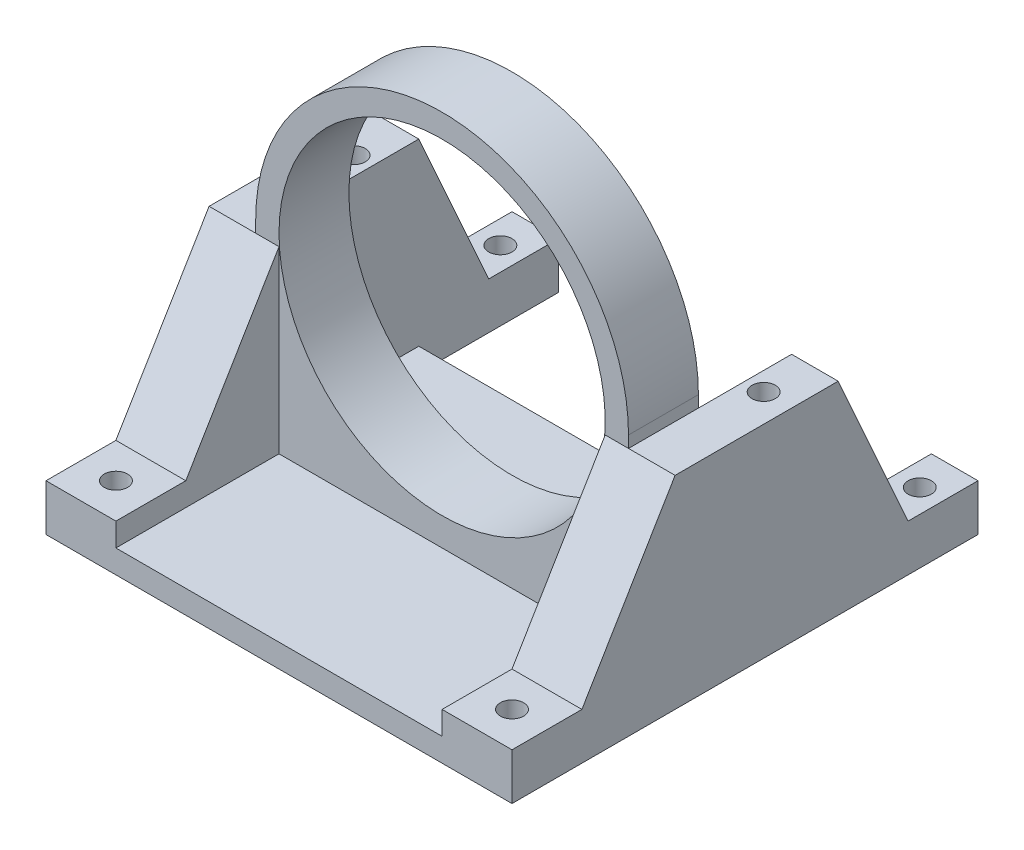
from build123d import *

# Parameters (mm, degrees)
SKETCH1_R                = 101.6
SKETCH1_R_2              = 88.9
BOSS_EXTRUDE1_DEPTH      = 38.1
SKETCH2_W                = 254
SKETCH2_H                = 177.8
BOSS_EXTRUDE2_DEPTH      = 12.7
BOSS_EXTRUDE3_REACH      = 275.106
BOSS_EXTRUDE3_END_RADIUS = 101.6
SKETCH3_W                = 203.2
SKETCH3_H                = 38.1
SKETCH10_W               = 25.4
SKETCH10_H               = 88.9
BOSS_EXTRUDE5_DEPTH      = 97.79
SKETCH11_R               = 6.35
CUT_EXTRUDE1_DEPTH       = 38.1
RIB3_START               = -38.1
RIB3_DEPTH               = 38.1
BOSS_EXTRUDE6_DEPTH      = 25.4
BOSS_EXTRUDE7_DEPTH      = 25.4
SKETCH17_R               = 6.35
CUT_EXTRUDE2_DEPTH       = 25.4


# Read off the part's stored shape, not the designer's step: Rib3
with BuildPart() as part:
    # Sketch1 → Boss-Extrude1 (new body)
    with BuildSketch(Plane.XY):
        with Locations(Location((0, 0, 0), (0, 0, 180))):
            Circle(SKETCH1_R)
        with Locations(Location((0, 0, 0), (0, 0, 180))):
            Circle(SKETCH1_R_2, mode=Mode.SUBTRACT)
    extrude(amount=BOSS_EXTRUDE1_DEPTH)



with BuildPart() as body_2:
    # Sketch2 → Boss-Extrude2 (new body)
    with BuildSketch(Plane(origin=(0, -116.84, 0), x_dir=(1, 0, 0), z_dir=(0, 1, 0))):
        with Locations((0, -38.1)):
            Rectangle(SKETCH2_W, SKETCH2_H)
    extrude(amount=BOSS_EXTRUDE2_DEPTH)


with BuildPart() as part_1:
    add(part.part)

    add(body_2.part)  # Boss-Extrude3 merges body 2
    # Boss-Extrude3: up to this cylinder (the profile starts outside it)
    boss_extrude3_end = Plane(origin=(0, 0, 19.05), z_dir=(0, 0, -1)) * Cylinder(BOSS_EXTRUDE3_END_RADIUS, 754.412, mode=Mode.PRIVATE)
    # Sketch3 → Boss-Extrude3 (add, up to the surface)
    with BuildSketch(Plane(origin=(0, -104.14, 0), x_dir=(1, 0, 0), z_dir=(0, 1, 0)), mode=Mode.PRIVATE) as boss_extrude3_sk1:
        with Locations((0, -19.05)):
            Rectangle(SKETCH3_W, SKETCH3_H)
    boss_extrude3_tool1 = extrude(boss_extrude3_sk1.sketch, amount=BOSS_EXTRUDE3_REACH, mode=Mode.PRIVATE) - boss_extrude3_end
    add(boss_extrude3_tool1.solids().sort_by_distance((0, -104.14, 19.05))[0])

    # Sketch10 → Boss-Extrude5 (add)
    with BuildSketch(Plane(origin=(0, -104.14, 0), x_dir=(1, 0, 0), z_dir=(0, 1, 0))):
        with Locations((-114.3, 6.35)):
            Rectangle(SKETCH10_W, SKETCH10_H)
    boss_extrude5 = extrude(amount=BOSS_EXTRUDE5_DEPTH)

    # Mirror1: Boss-Extrude5 across plane
    add(boss_extrude5.mirror(Plane(origin=(0, 0, 0), x_dir=(0, 0, 1), z_dir=(1, 0, 0))))

    # Sketch11 → Cut-Extrude1 (cut)
    with BuildSketch(Plane(origin=(0, -6.35, 0), x_dir=(1, 0, 0), z_dir=(0, 1, 0))):
        with Locations(Location((-111.76, 25.4, 0), (0, 0, 270))):
            Circle(SKETCH11_R)
    cut_extrude1 = extrude(amount=-CUT_EXTRUDE1_DEPTH, mode=Mode.SUBTRACT)

    # Mirror2: Cut-Extrude1 across plane
    add(cut_extrude1.mirror(Plane(origin=(0, 0, 0), x_dir=(0, 0, 1), z_dir=(1, 0, 0))), mode=Mode.SUBTRACT)

    # Rib3 outline → Rib3 (add)
    with BuildSketch(Plane.ZY.offset(127).offset(RIB3_START)):
        Polygon((127, -104.14), (127, -91.44), (88.9, -91.44), (38.1, -6.35), (38.1, -104.14), align=None)
    rib3 = extrude(amount=RIB3_DEPTH)

    # Mirror3: Rib3 across plane
    add(rib3.mirror(Plane(origin=(0, 0, 0), x_dir=(0, 0, 1), z_dir=(1, 0, 0))))

    # Sketch15 → Boss-Extrude6 (add)
    with BuildSketch(Plane.ZY.offset(127)):
        Polygon((-50.8, -6.35), (-50.8, -116.84), (-127, -116.84), (-127, -91.44), (-88.9, -91.44), align=None)
    extrude(amount=-BOSS_EXTRUDE6_DEPTH)

    # Sketch16 → Boss-Extrude7 (add)
    with BuildSketch(Plane(origin=(127, 0, 0), x_dir=(0, 0, -1), z_dir=(1, 0, 0))):
        Polygon((50.8, -6.35), (88.9, -91.44), (127, -91.44), (127, -116.84), (50.8, -116.84), align=None)
    extrude(amount=-BOSS_EXTRUDE7_DEPTH)

    # Sketch17 → Cut-Extrude2 (cut)
    with BuildSketch(Plane(origin=(0, -91.44, 0), x_dir=(1, 0, 0), z_dir=(0, 1, 0))):
        with Locations(Location((114.3, 107.95, 0), (0, 0, 270))):
            Circle(SKETCH17_R)
        with Locations(Location((-114.3, 107.95, 0), (0, 0, 270))):
            Circle(SKETCH17_R)
        with Locations(Location((-107.95, -107.95, 0), (0, 0, 270))):
            Circle(SKETCH17_R)
        with Locations(Location((107.95, -107.95, 0), (0, 0, 270))):
            Circle(SKETCH17_R)
    extrude(amount=-CUT_EXTRUDE2_DEPTH, mode=Mode.SUBTRACT)


solid = part_1.part
